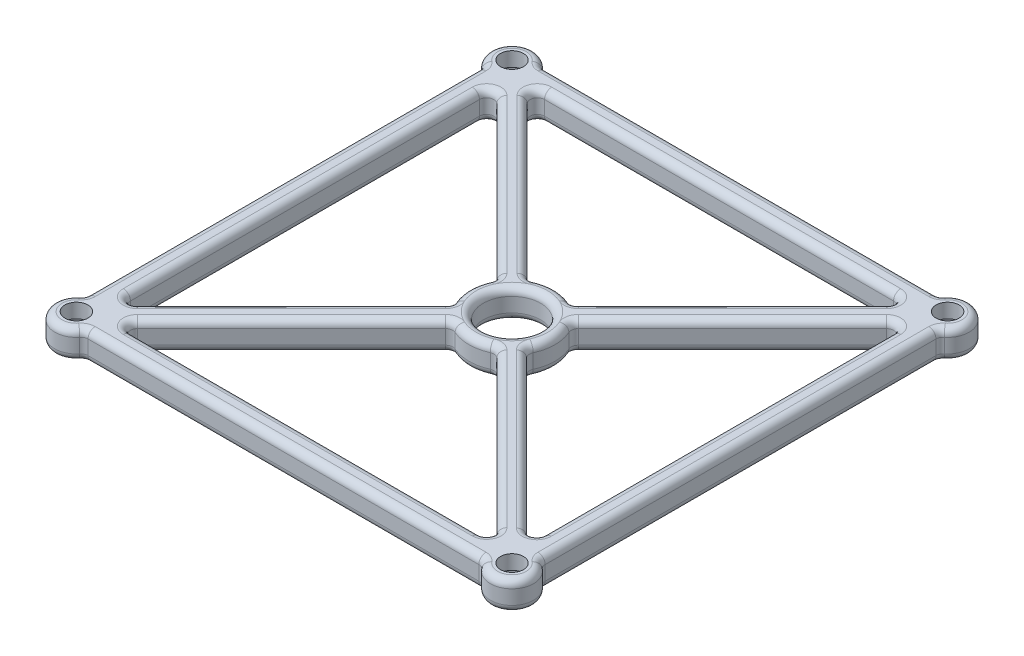
from build123d import *

# Parameters (mm, degrees)
BOSS_EXTRUDE1_DEPTH = 2
SKETCH2_R           = 2
CUT_EXTRUDE1_DEPTH  = 2
SKETCH3_R           = 0.8
CUT_EXTRUDE2_DEPTH  = 2
FILLET3_R           = 0.5
FILLET4_R           = 0.5
FILLET5_R           = 0.5
SKETCH4_R           = 1.2
CUT_EXTRUDE3_DEPTH  = 1
FILLET6_R           = 0.1
FILLET7_R           = 0.1
FILLET8_R           = 0.1
FILLET9_R           = 0.1


with BuildPart() as part:
    # Sketch1 → Boss-Extrude1 (new body)
    with BuildSketch(Plane(origin=(0, 0, 0), x_dir=(1, 0, 0), z_dir=(0, 1, 0))):
        with BuildLine():
            Line((15.925, 13.875961894), (15.925, -13.875961894))
            ThreePointArc((15.925, -13.875961894), (16.235660172, -16.235660172), (13.875961894, -15.925))
            Line((13.875961894, -15.925), (-13.875961894, -15.925))
            ThreePointArc((-13.875961894, -15.925), (-16.235660172, -16.235660172), (-15.925, -13.875961894))
            Line((-15.925, -13.875961894), (-15.925, 13.875961894))
            ThreePointArc((-15.925, 13.875961894), (-16.235660172, 16.235660172), (-13.875961894, 15.925))
            Line((-13.875961894, 15.925), (13.875961894, 15.925))
            ThreePointArc((13.875961894, 15.925), (16.235660172, 16.235660172), (15.925, 13.875961894))
        make_face()
        with BuildLine():
            Line((-14.425, 13.364339828), (-2.584289677, 1.523629505))
            ThreePointArc((-2.584289677, 1.523629505), (-3, 0), (-2.584289677, -1.523629505))
            Line((-2.584289677, -1.523629505), (-14.425, -13.364339828))
            Line((-14.425, -13.364339828), (-14.425, 13.364339828))
        make_face(mode=Mode.SUBTRACT)
        with BuildLine():
            Line((1.523629505, 2.584289677), (13.364339828, 14.425))
            Line((13.364339828, 14.425), (-13.364339828, 14.425))
            Line((-13.364339828, 14.425), (-1.523629505, 2.584289677))
            ThreePointArc((-1.523629505, 2.584289677), (0, 3), (1.523629505, 2.584289677))
        make_face(mode=Mode.SUBTRACT)
        with BuildLine():
            Line((-13.364339828, -14.425), (13.364339828, -14.425))
            Line((13.364339828, -14.425), (1.523629505, -2.584289677))
            ThreePointArc((1.523629505, -2.584289677), (0, -3), (-1.523629505, -2.584289677))
            Line((-1.523629505, -2.584289677), (-13.364339828, -14.425))
        make_face(mode=Mode.SUBTRACT)
        with BuildLine():
            Line((2.584289677, 1.523629505), (14.425, 13.364339828))
            Line((14.425, 13.364339828), (14.425, -13.411248335))
            Line((14.425, -13.411248335), (2.56674886, -1.552997196))
            ThreePointArc((2.56674886, -1.552997196), (2.999951244, -0.017103666), (2.584289677, 1.523629505))
        make_face(mode=Mode.SUBTRACT)
    extrude(amount=BOSS_EXTRUDE1_DEPTH)

    # Sketch2 → Cut-Extrude1 (cut)
    with BuildSketch(Plane(origin=(0, 2, 0), x_dir=(1, 0, 0), z_dir=(0, 1, 0))):
        with Locations(Location((0, 0, 0), (0, 0, 270))):
            Circle(SKETCH2_R)
    extrude(amount=-CUT_EXTRUDE1_DEPTH, mode=Mode.SUBTRACT)

    # Sketch3 → Cut-Extrude2 (cut)
    with BuildSketch(Plane(origin=(0, 2, 0), x_dir=(1, 0, 0), z_dir=(0, 1, 0))):
        with Locations(Location((15.175, 15.175, 0), (0, 0, 270))):
            Circle(SKETCH3_R)
        with Locations(Location((15.175, -15.175, 0), (0, 0, 270))):
            Circle(SKETCH3_R)
        with Locations(Location((-15.175, 15.175, 0), (0, 0, 270))):
            Circle(SKETCH3_R)
        with Locations(Location((-15.175, -15.175, 0), (0, 0, 270))):
            Circle(SKETCH3_R)
    extrude(amount=-CUT_EXTRUDE2_DEPTH, mode=Mode.SUBTRACT)

    # Fillet3
    fillet3_edges = [part.edges().sort_by_distance(p)[0] for p in [
        (2.999951244, 0, 0.017103666),
        (2.584289677, 1, -1.523629505),
        (8.49587443, 0, 7.482122766),
        (2.56674886, 1, 1.552997196),
        (14.425, 0, 0.023454254),
        (14.425, 1, 13.411248335),
        (8.504644838, 0, -7.443984666),
        (14.425, 1, -13.364339828),
        (2.999951244, 2, 0.017103666),
        (8.49587443, 2, 7.482122766),
        (14.425, 2, 0.023454254),
        (8.504644838, 2, -7.443984666),
        (0, 0, -3),
        (-1.523629505, 1, -2.584289677),
        (7.443984666, 0, -8.504644838),
        (1.523629505, 1, -2.584289677),
        (0, 0, -14.425),
        (13.364339828, 1, -14.425),
        (-7.443984666, 0, -8.504644838),
        (-13.364339828, 1, -14.425),
        (0, 2, -3),
        (7.443984666, 2, -8.504644838),
        (0, 2, -14.425),
        (-7.443984666, 2, -8.504644838),
        (-8.504644838, 0, 7.443984666),
        (-14.425, 1, 13.364339828),
        (-3, 0, 0),
        (-2.584289677, 1, 1.523629505),
        (-8.504644838, 0, -7.443984666),
        (-2.584289677, 1, -1.523629505),
        (-14.425, 0, 0),
        (-14.425, 1, -13.364339828),
        (-8.504644838, 2, 7.443984666),
        (-3, 2, 0),
        (-8.504644838, 2, -7.443984666),
        (-14.425, 2, 0),
        (-7.443984666, 0, 8.504644838),
        (-1.523629505, 1, 2.584289677),
        (0, 0, 14.425),
        (-13.364339828, 1, 14.425),
        (7.443984666, 0, 8.504644838),
        (13.364339828, 1, 14.425),
        (0, 0, 3),
        (1.523629505, 1, 2.584289677),
        (-7.443984666, 2, 8.504644838),
        (0, 2, 14.425),
        (7.443984666, 2, 8.504644838),
        (0, 2, 3),
    ]]
    fillet(fillet3_edges, radius=FILLET3_R)

    # Fillet4
    fillet4_edges = [part.edges().sort_by_distance(p)[0] for p in [
        (0, 0, -2),
        (0, 2, -2),
    ]]
    fillet(fillet4_edges, radius=FILLET4_R - 0.0001)  # a hair under: the kernel refuses the full size

    # Fillet5
    fillet5_edges = [part.edges().sort_by_distance(p)[0] for p in [
        (16.235660172, 2, 16.235660172),
        (0, 0, 15.925),
        (-16.235660172, 0, 16.235660172),
        (15.925, 2, 0),
        (-15.925, 1, 13.875961894),
        (-15.925, 1, -13.875961894),
        (-13.875961894, 1, -15.925),
        (13.875961894, 1, -15.925),
        (15.925, 1, -13.875961894),
        (15.925, 1, 13.875961894),
        (13.875961894, 1, 15.925),
        (-13.875961894, 1, 15.925),
        (16.235660172, 2, -16.235660172),
        (0, 2, -15.925),
        (-16.235660172, 2, -16.235660172),
        (-15.925, 2, 0),
        (-16.235660172, 2, 16.235660172),
        (0, 2, 15.925),
        (-15.925, 0, 0),
        (-16.235660172, 0, -16.235660172),
        (0, 0, -15.925),
        (16.235660172, 0, -16.235660172),
        (15.925, 0, 0),
        (16.235660172, 0, 16.235660172),
    ]]
    fillet(fillet5_edges, radius=FILLET5_R)

    # Sketch4 → Cut-Extrude3 (cut)
    with BuildSketch(Plane.XZ):
        with Locations(Location((-15.175, 15.175, 0), (0, 0, 270))):
            Circle(SKETCH4_R)
        with Locations(Location((15.175, 15.175, 0), (0, 0, 270))):
            Circle(SKETCH4_R)
        with Locations(Location((-15.175, -15.175, 0), (0, 0, 270))):
            Circle(SKETCH4_R)
        with Locations(Location((15.175, -15.175, 0), (0, 0, 270))):
            Circle(SKETCH4_R)
    extrude(amount=-CUT_EXTRUDE3_DEPTH, mode=Mode.SUBTRACT)

    # Fillet6
    fillet6_edges = [part.edges().sort_by_distance(p)[0] for p in [
        (-14.110720428, 0.021508496, -15.729354579),
        (-15.729354579, 0.021508496, -14.110720428),
        (-16.307276388, 0.041742431, -15.572429466),
        (-14.326471863, 0, -14.326471863),
    ]]
    fillet(fillet6_edges, radius=FILLET6_R)

    # Fillet7
    fillet7_edges = [part.edges().sort_by_distance(p)[0] for p in [
        (-15.729354579, 0.021508496, 14.110720428),
        (-14.110720428, 0.021508496, 15.729354579),
        (-16.023528137, 0.041742431, 16.023528137),
        (-14.21443269, 0, 14.455757035),
    ]]
    fillet(fillet7_edges, radius=FILLET7_R)

    # Fillet8
    fillet8_edges = [part.edges().sort_by_distance(p)[0] for p in [
        (15.729354579, 0.021508496, 14.110720428),
        (16.023528137, 0.041742431, 16.023528137),
        (14.110720428, 0.021508496, 15.729354579),
        (14.21443269, 0, 14.455757035),
    ]]
    fillet(fillet8_edges, radius=FILLET8_R)

    # Fillet9
    fillet9_edges = [part.edges().sort_by_distance(p)[0] for p in [
        (14.110720428, 0.021508496, -15.729354579),
        (16.307276388, 0.041742431, -15.572429466),
        (15.729354579, 0.021508496, -14.110720428),
        (14.326471863, 0, -14.326471863),
    ]]
    fillet(fillet9_edges, radius=FILLET9_R)


solid = part.part
